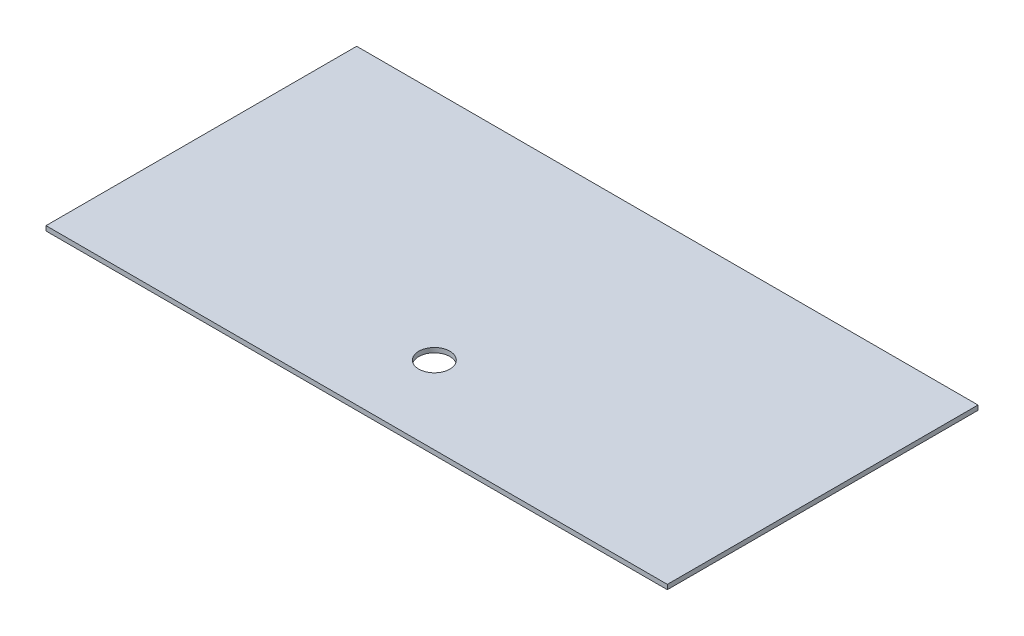
from build123d import *

# Parameters (mm, degrees)
SKETCH1_W           = 2400
SKETCH1_H           = 1200
SKETCH1_R           = 60
BOSS_EXTRUDE1_DEPTH = 18


with BuildPart() as part:
    # Sketch1 → Boss-Extrude1 (new body)
    with BuildSketch(Plane(origin=(0, 0, 0), x_dir=(1, 0, 0), z_dir=(0, 1, 0))):
        Rectangle(SKETCH1_W, SKETCH1_H)
        with Locations((0, -300)):
            Circle(SKETCH1_R, mode=Mode.SUBTRACT)
    extrude(amount=BOSS_EXTRUDE1_DEPTH)


solid = part.part
